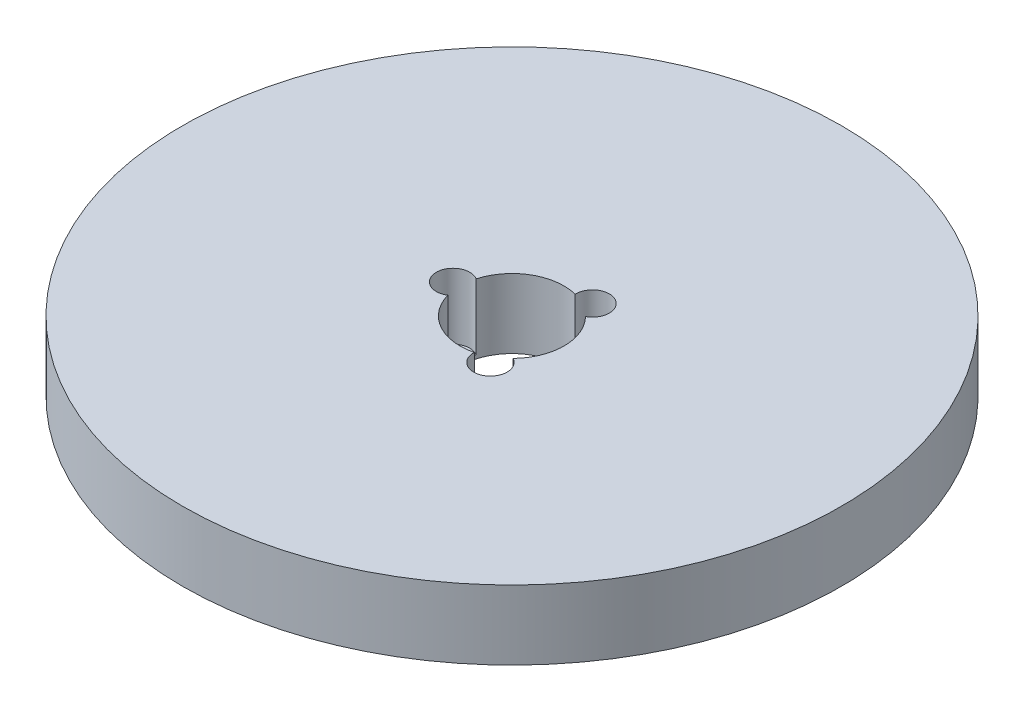
from build123d import *

# Parameters (mm, degrees)
SKETCH1_R           = 47.5
BOSS_EXTRUDE1_DEPTH = 10
SKETCH2_R           = 7.5
CUT_EXTRUDE1_DEPTH  = 68.915388536
SKETCH3_R           = 2.413015277
CUT_EXTRUDE2_DEPTH  = 9.483774829
CIRPATTERN1_COUNT   = 3


with BuildPart() as part:
    # Sketch1 → Boss-Extrude1 (new body)
    with BuildSketch(Plane(origin=(0, 0, 0), x_dir=(1, 0, 0), z_dir=(0, 1, 0))):
        Circle(SKETCH1_R)
    extrude(amount=BOSS_EXTRUDE1_DEPTH)

    # Sketch2 → Cut-Extrude1 (cut, through all)
    with BuildSketch(Plane(origin=(0, 0, 0), x_dir=(1, 0, 0), z_dir=(0, 1, 0))):
        Circle(SKETCH2_R)
    extrude(amount=CUT_EXTRUDE1_DEPTH, mode=Mode.SUBTRACT)

    # Sketch3 → Cut-Extrude2 (cut)
    with BuildSketch(Plane(origin=(0, 10, 0), x_dir=(1, 0, 0), z_dir=(0, 1, 0))):
        with Locations((-8.498727367, 0)):
            Circle(SKETCH3_R)
    cut_extrude2 = extrude(amount=-CUT_EXTRUDE2_DEPTH, mode=Mode.SUBTRACT)

    # CirPattern1: Cut-Extrude2 ×3 about axis
    cirpattern1_axis = Axis((0, 0, 0), (0, 1, 0))
    for i in range(1, CIRPATTERN1_COUNT):
        add(cut_extrude2.rotate(cirpattern1_axis, i * 360 / CIRPATTERN1_COUNT), mode=Mode.SUBTRACT)


solid = part.part
